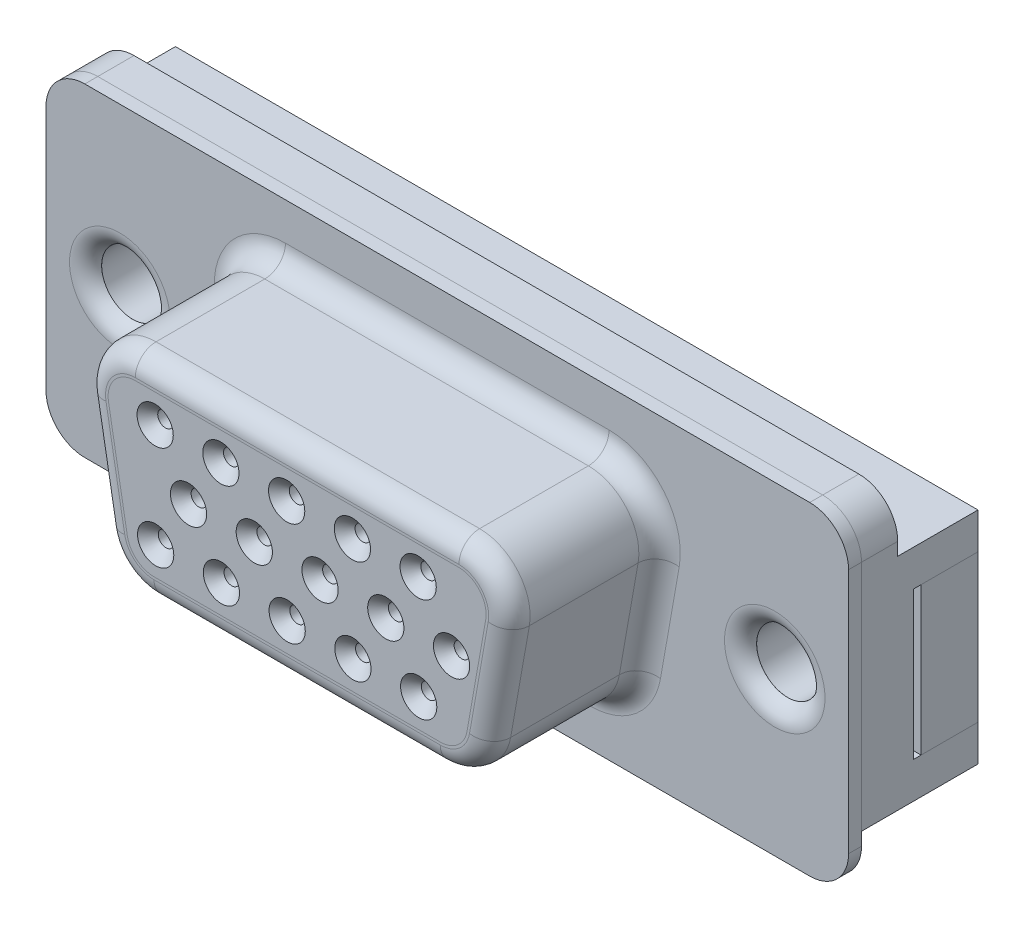
from build123d import *

# Parameters (mm, degrees)
CROQUIS1_W            = 31
CROQUIS1_H            = 12.5
EXTRUIR1_DEPTH        = 0.5
REDONDEO1_R           = 1.5
EXTRUIR2_DEPTH        = 5.8
CORTAR_EXTRUIR1_DEPTH = 9.8
REDONDEO2_R           = 0.8
REDONDEO3_R           = 0.8
CROQUIS4_R            = 1.2
CORTAR_EXTRUIR2_DEPTH = 9.8
REDONDEO4_R           = 0.8
EXTRUIR3_DEPTH        = 4.5
CROQUIS6_W            = 4.094383516
CROQUIS6_H            = 3.116234629
CORTAR_EXTRUIR3_DEPTH = 36.5
CROQUIS7_W            = 5.7
CROQUIS7_H            = 5.7
CORTAR_EXTRUIR4_DEPTH = 2.5
CROQUIS8_R            = 1.2
CORTAR_EXTRUIR5_DEPTH = 2.5
EXTRUIR4_DEPTH        = 6.3
CROQUIS10_R           = 0.3
CORTAR_EXTRUIR6_DEPTH = 9.3
CHAFL_N1_SIZE         = 0.4
CROQUIS11_W           = 5.7
CROQUIS11_H           = 5.7
CROQUIS11_R           = 1.2
EXTRUIR5_DEPTH        = 2.2
EXTRUIR5_2_DEPTH      = 2.2


with BuildPart() as part:
    # Croquis1 → Extruir1 (new body)
    with BuildSketch(Plane.XY):
        Rectangle(CROQUIS1_W, CROQUIS1_H)
    extrude(amount=EXTRUIR1_DEPTH)

    # Redondeo1
    redondeo1_edges = [part.edges().sort_by_distance(p)[0] for p in [
        (-15.5, 6.25, 0.25),
        (15.5, 6.25, 0.25),
        (15.5, -6.25, 0.25),
        (-15.5, -6.25, 0.25),
    ]]
    fillet(redondeo1_edges, radius=REDONDEO1_R)

    # Croquis2 → Extruir2 (add)
    with BuildSketch(Plane.XY.offset(0.5)):
        with BuildLine():
            Line((-6.25, 4), (6.25, 4))
            ThreePointArc((6.25, 4), (7.743786664, 3.303435839), (8.170375118, 1.711386054))
            Line((8.170375118, 1.711386054), (7.447434497, -2.388613946))
            ThreePointArc((7.447434497, -2.388613946), (6.780495218, -3.543786664), (5.527059379, -4))
            Line((5.527059379, -4), (-5.527059379, -4))
            ThreePointArc((-5.527059379, -4), (-6.780495218, -3.543786664), (-7.447434497, -2.388613946))
            Line((-7.447434497, -2.388613946), (-8.170375118, 1.711386054))
            ThreePointArc((-8.170375118, 1.711386054), (-7.743786664, 3.303435839), (-6.25, 4))
        make_face()
    extrude(amount=EXTRUIR2_DEPTH)

    # Croquis3 → Cortar-Extruir1 (cut)
    with BuildSketch(Plane.XY.offset(6.3)):
        with BuildLine():
            Line((-5.527059379, -3.1), (5.527059379, -3.1))
            ThreePointArc((5.527059379, -3.1), (6.201986369, -2.854346665), (6.56110752, -2.232330587))
            Line((6.56110752, -2.232330587), (7.284048141, 1.867669413))
            ThreePointArc((7.284048141, 1.867669413), (7.054346665, 2.72492699), (6.25, 3.1))
            Line((6.25, 3.1), (-6.25, 3.1))
            ThreePointArc((-6.25, 3.1), (-7.054346665, 2.72492699), (-7.284048141, 1.867669413))
            Line((-7.284048141, 1.867669413), (-6.56110752, -2.232330587))
            ThreePointArc((-6.56110752, -2.232330587), (-6.201986369, -2.854346665), (-5.527059379, -3.1))
        make_face()
    extrude(amount=-CORTAR_EXTRUIR1_DEPTH, mode=Mode.SUBTRACT)

    # Redondeo2
    redondeo2_edges = [part.edges().sort_by_distance(p)[0] for p in [
        (-6.780495218, -3.543786664, 6.3),
        (0, -4, 6.3),
        (6.780495218, -3.543786664, 6.3),
        (7.808904808, -0.338613946, 6.3),
        (7.743786664, 3.303435839, 6.3),
        (0, 4, 6.3),
        (-7.743786664, 3.303435839, 6.3),
        (-7.808904808, -0.338613946, 6.3),
    ]]
    fillet(redondeo2_edges, radius=REDONDEO2_R)

    # Redondeo3
    redondeo3_edges = [part.edges().sort_by_distance(p)[0] for p in [
        (-6.780495218, -3.543786664, 0.5),
        (0, -4, 0.5),
        (6.780495218, -3.543786664, 0.5),
        (7.808904808, -0.338613946, 0.5),
        (7.743786664, 3.303435839, 0.5),
        (0, 4, 0.5),
        (-7.743786664, 3.303435839, 0.5),
        (-7.808904808, -0.338613946, 0.5),
    ]]
    fillet(redondeo3_edges, radius=REDONDEO3_R)

    # Croquis4 → Cortar-Extruir2 (cut)
    with BuildSketch(Plane.XY.offset(0.5)):
        with Locations((12.65, 0)):
            Circle(CROQUIS4_R)
        with Locations((-12.65, 0)):
            Circle(CROQUIS4_R)
    extrude(amount=-CORTAR_EXTRUIR2_DEPTH, mode=Mode.SUBTRACT)

    # Redondeo4
    # the kernel refuses this fillet: 0.8 mm, written as the material it takes off along each edge
    with BuildSketch(Plane(origin=(12.65, 0, 0.5), x_dir=(1, 0, 0), z_dir=(0, -1, 0))) as redondeo4_piece_1:
        with BuildLine():
            CenterArc((1.941619849, -0.8), REDONDEO4_R, 90, 67.975687163)
            Line((1.2, -0.5), (1.185167603, -0.494))
            ThreePointArc((1.185167603, -0.494), (1.184, -0.25), (1.184, 0))
            Line((1.184, 0), (1.2, 0.016))
            Line((1.2, 0.016), (1.941619849, 0.016))
            Line((1.941619849, 0.016), (1.941619849, 0))
        make_face()
    revolve(axis=Axis((12.65, 0, 0.5), (0, 0, 1)), mode=Mode.SUBTRACT)
    with BuildSketch(Plane(origin=(-12.65, 0, 0.5), x_dir=(1, 0, 0), z_dir=(0, -1, 0))) as redondeo4_piece_2:
        with BuildLine():
            CenterArc((1.941619849, -0.8), REDONDEO4_R, 90, 67.975687163)
            Line((1.2, -0.5), (1.185167603, -0.494))
            ThreePointArc((1.185167603, -0.494), (1.184, -0.25), (1.184, 0))
            Line((1.184, 0), (1.2, 0.016))
            Line((1.2, 0.016), (1.941619849, 0.016))
            Line((1.941619849, 0.016), (1.941619849, 0))
        make_face()
    revolve(axis=Axis((-12.65, 0, 0.5), (0, 0, 1)), mode=Mode.SUBTRACT)


with BuildPart() as body_2:
    # Croquis5 → Extruir3 (new body)
    with BuildSketch(Plane(origin=(0, 0, 0), x_dir=(-1, 0, 0), z_dir=(0, 0, -1))):
        with BuildLine():
            Line((-14, 6.25), (14, 6.25))
            ThreePointArc((14, 6.25), (15.060660172, 5.810660172), (15.5, 4.75))
            Line((15.5, 4.75), (15.5, -4.25))
            Line((15.5, -4.25), (-15.5, -4.25))
            Line((-15.5, -4.25), (-15.5, 4.75))
            ThreePointArc((-15.5, 4.75), (-15.060660172, 5.810660172), (-14, 6.25))
        make_face()
    extrude(amount=EXTRUIR3_DEPTH)

    # Croquis6 → Cortar-Extruir3 (cut)
    with BuildSketch(Plane(origin=(15.5, 0, 0), x_dir=(0, 0, -1), z_dir=(1, 0, 0))):
        with Locations((3.447191758, 5.808117315)):
            Rectangle(CROQUIS6_W, CROQUIS6_H)
    extrude(amount=-CORTAR_EXTRUIR3_DEPTH, mode=Mode.SUBTRACT)

    # Croquis7 → Cortar-Extruir4 (cut)
    with BuildSketch(Plane(origin=(0, 0, -4.5), x_dir=(-1, 0, 0), z_dir=(0, 0, -1))):
        with Locations((-12.65, 0)):
            Rectangle(CROQUIS7_W, CROQUIS7_H)
        with Locations((12.65, 0)):
            Rectangle(CROQUIS7_W, CROQUIS7_H)
    extrude(amount=-CORTAR_EXTRUIR4_DEPTH, mode=Mode.SUBTRACT)

    # Croquis8 → Cortar-Extruir5 (cut)
    with BuildSketch(Plane(origin=(0, 0, -2), x_dir=(-1, 0, 0), z_dir=(0, 0, -1))):
        with Locations((-12.65, 0)):
            Circle(CROQUIS8_R)
        with Locations((12.65, 0)):
            Circle(CROQUIS8_R)
    extrude(amount=-CORTAR_EXTRUIR5_DEPTH, mode=Mode.SUBTRACT)


with BuildPart() as body_3:
    # Croquis9 → Extruir4 (new body)
    with BuildSketch(Plane.XY):
        with BuildLine():
            Line((6.56110752, -2.232330587), (7.284048141, 1.867669413))
            ThreePointArc((7.284048141, 1.867669413), (7.054346665, 2.72492699), (6.25, 3.1))
            Line((6.25, 3.1), (-6.25, 3.1))
            ThreePointArc((-6.25, 3.1), (-7.054346665, 2.72492699), (-7.284048141, 1.867669413))
            Line((-7.284048141, 1.867669413), (-6.56110752, -2.232330587))
            ThreePointArc((-6.56110752, -2.232330587), (-6.201986369, -2.854346665), (-5.527059379, -3.1))
            Line((-5.527059379, -3.1), (5.527059379, -3.1))
            ThreePointArc((5.527059379, -3.1), (6.201986369, -2.854346665), (6.56110752, -2.232330587))
        make_face()
    extrude(amount=EXTRUIR4_DEPTH)


with BuildPart() as cortar_extruir6_tool:
    # Croquis10 → Cortar-Extruir6 (new body)
    with BuildSketch(Plane.XY.offset(6.3)):
        with Locations((-5.484048141, 2)):
            Circle(CROQUIS10_R)
        with Locations((-2.944048141, 2)):
            Circle(CROQUIS10_R)
        with Locations((-0.404048141, 2)):
            Circle(CROQUIS10_R)
        with Locations((2.135951859, 2)):
            Circle(CROQUIS10_R)
        with Locations((4.675951859, 2)):
            Circle(CROQUIS10_R)
        with Locations((4.695777882, -2)):
            Circle(CROQUIS10_R)
        with Locations((2.155777882, -2)):
            Circle(CROQUIS10_R)
        with Locations((-0.384222118, -2)):
            Circle(CROQUIS10_R)
        with Locations((-2.924222118, -2)):
            Circle(CROQUIS10_R)
        with Locations((-5.464222118, -2)):
            Circle(CROQUIS10_R)
        with Locations((0.885777882, 0)):
            Circle(CROQUIS10_R)
        with Locations((3.425777882, 0)):
            Circle(CROQUIS10_R)
        with Locations((5.965777882, 0)):
            Circle(CROQUIS10_R)
        with Locations((-1.654222118, 0)):
            Circle(CROQUIS10_R)
        with Locations((-4.194222118, 0)):
            Circle(CROQUIS10_R)
    extrude(amount=-CORTAR_EXTRUIR6_DEPTH)


with BuildPart() as body_2_1:
    add(body_2.part)

    # Cortar-Extruir6: cut by cortar_extruir6_tool
    add(cortar_extruir6_tool.part, mode=Mode.SUBTRACT)


with BuildPart() as body_3_1:
    add(body_3.part)

    # Cortar-Extruir6: cut by cortar_extruir6_tool
    add(cortar_extruir6_tool.part, mode=Mode.SUBTRACT)

    # Chaflán1
    chafl_n1_edges = [body_3_1.edges().sort_by_distance(p)[0] for p in [
        (-5.784048141, 2, 6.3),
        (-3.244048141, 2, 6.3),
        (-0.704048141, 2, 6.3),
        (1.835951859, 2, 6.3),
        (4.375951859, 2, 6.3),
        (-5.764222118, -2, 6.3),
        (-3.224222118, -2, 6.3),
        (-0.684222118, -2, 6.3),
        (1.855777882, -2, 6.3),
        (4.395777882, -2, 6.3),
        (-4.494222118, 0, 6.3),
        (-1.954222118, 0, 6.3),
        (0.585777882, 0, 6.3),
        (3.125777882, 0, 6.3),
        (5.665777882, 0, 6.3),
    ]]
    chamfer(chafl_n1_edges, length=CHAFL_N1_SIZE)

    # Combinar1: union body 2
    add(body_2_1.part)


with BuildPart() as body_3_2:
    # Croquis11 → Extruir5 (new body)
    with BuildSketch(Plane(origin=(0, 0, -4.5), x_dir=(-1, 0, 0), z_dir=(0, 0, -1))):
        with Locations((-12.65, 0)):
            Rectangle(CROQUIS11_W, CROQUIS11_H)
        with Locations((-12.65, 0)):
            Circle(CROQUIS11_R, mode=Mode.SUBTRACT)
    extrude(amount=-EXTRUIR5_DEPTH)


with BuildPart() as body_4:
    # Croquis11 → Extruir5 2 (new body)
    with BuildSketch(Plane(origin=(0, 0, -4.5), x_dir=(-1, 0, 0), z_dir=(0, 0, -1))):
        with Locations((12.65, 0)):
            Rectangle(CROQUIS11_W, CROQUIS11_H)
        with Locations((12.65, 0)):
            Circle(CROQUIS11_R, mode=Mode.SUBTRACT)
    extrude(amount=-EXTRUIR5_2_DEPTH)


solid = Compound([part.part, body_3_1.part, body_3_2.part, body_4.part])
